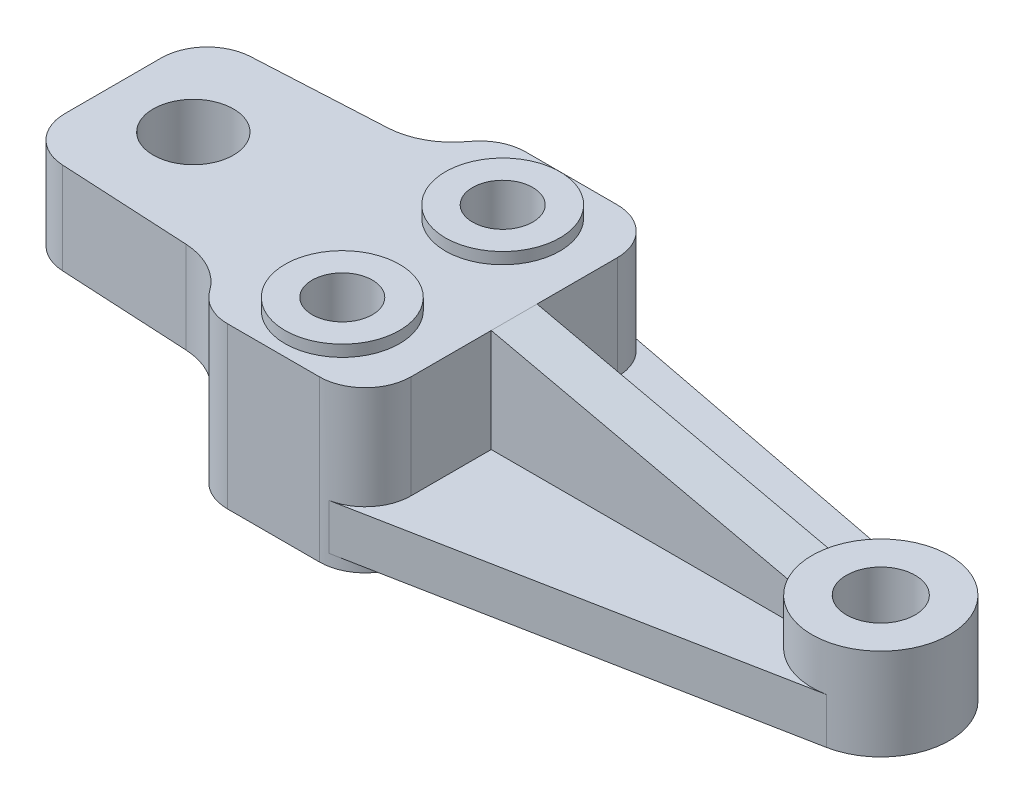
from build123d import *

# Parameters (mm, degrees)
SKETCH1_R                = 8.334375
SKETCH1_R_2              = 19.05
SKETCH1_R_3              = 9.525
SKETCH1_R_4              = 15.875
BOSS_EXTRUDE3_DEPTH      = 12.7
BOSS_EXTRUDE4_DEPTH      = 41.275
BOSS_EXTRUDE4_DEPTH_BACK = 3.175
SKETCH1_5_R              = 8.334375
SKETCH1_5_R_2            = 15.875
SKETCH1_6_R              = 19.05
SKETCH1_6_R_2            = 9.525
BOSS_EXTRUDE5_DEPTH      = 25.4
RIB1_START               = -6.35
RIB1_DEPTH               = 12.7
BOSS_EXTRUDE6_START      = 41.275
SKETCH1_7_R              = 15.875
SKETCH1_7_R_2            = 8.334375
BOSS_EXTRUDE6_DEPTH      = 3.175
BOSS_EXTRUDE8_START      = -25.4
SKETCH4_R                = 11.1125
BOSS_EXTRUDE8_DEPTH      = 25.4


# Read off the part's stored shape, not the designer's step: Rib1
with BuildPart() as part:
    # Sketch1 → Boss-Extrude3 (new body)
    # profile 1 of 5: a face of its own
    with BuildSketch(Plane(origin=(0, 0, 0), x_dir=(1, 0, 0), z_dir=(0, 1, 0))):
        with BuildLine():
            ThreePointArc((40.51167311, 41.043914661), (47.895872817, 36.657751744), (50.8, 28.575))
            Line((50.8, 28.575), (50.8, -28.575))
            ThreePointArc((50.8, -28.575), (47.895872817, -36.657751744), (40.51167311, -41.043914661))
            Line((40.51167311, -41.043914661), (156.017509664, -18.703371991))
            ThreePointArc((156.017509664, -18.703371991), (133.35, 0), (156.017509664, 18.703371991))
            Line((156.017509664, 18.703371991), (40.51167311, 41.043914661))
        make_face()
    # profile 2 of 5: a face of its own
    with BuildSketch(Plane(origin=(0, 0, 0), x_dir=(1, 0, 0), z_dir=(0, 1, 0))):
        with BuildLine():
            ThreePointArc((38.1, 41.275), (47.080256121, 37.555256121), (50.8, 28.575))
            Line((50.8, 28.575), (50.8, -28.575))
            ThreePointArc((50.8, -28.575), (47.080256121, -37.555256121), (38.1, -41.275))
            Line((38.1, -41.275), (12.7, -41.275))
            ThreePointArc((12.7, -41.275), (3.719743879, -37.555256121), (0, -28.575))
            Line((0, -28.575), (0, 28.575))
            ThreePointArc((0, 28.575), (3.719743879, 37.555256121), (12.7, 41.275))
            Line((12.7, 41.275), (38.1, 41.275))
        make_face()
        with Locations(Location((25.4, -22.225, 0), (0, 0, 270))):
            Circle(SKETCH1_R, mode=Mode.SUBTRACT)
        with Locations(Location((25.4, 22.225, 0), (0, 0, 270))):
            Circle(SKETCH1_R, mode=Mode.SUBTRACT)
    # profile 3 of 5: a face of its own
    with BuildSketch(Plane(origin=(0, 0, 0), x_dir=(1, 0, 0), z_dir=(0, 1, 0))):
        with Locations((152.4, 0)):
            Circle(SKETCH1_R_2)
        with Locations(Location((152.4, 0, 0), (0, 0, 270))):
            Circle(SKETCH1_R_3, mode=Mode.SUBTRACT)
    # profile 4 of 5: a face of its own
    with BuildSketch(Plane(origin=(0, 0, 0), x_dir=(1, 0, 0), z_dir=(0, 1, 0))):
        with Locations((25.4, 22.225)):
            Circle(SKETCH1_R_4)
        with Locations(Location((25.4, 22.225, 0), (0, 0, 270))):
            Circle(SKETCH1_R, mode=Mode.SUBTRACT)
    # profile 5 of 5: a face of its own
    with BuildSketch(Plane(origin=(0, 0, 0), x_dir=(1, 0, 0), z_dir=(0, 1, 0))):
        with Locations((25.4, -22.225)):
            Circle(SKETCH1_R_4)
        with Locations(Location((25.4, -22.225, 0), (0, 0, 270))):
            Circle(SKETCH1_R, mode=Mode.SUBTRACT)
    extrude(amount=BOSS_EXTRUDE3_DEPTH)

    # Sketch1<5> → Boss-Extrude4 (add, two sides: drawn at the far end of the back side and taken through both)
    # profile 1 of 3: a face of its own
    with BuildSketch(Plane(origin=(0, 0, 0), x_dir=(1, 0, 0), z_dir=(0, 1, 0)).offset(-BOSS_EXTRUDE4_DEPTH_BACK)):
        with BuildLine():
            ThreePointArc((38.1, 41.275), (47.080256121, 37.555256121), (50.8, 28.575))
            Line((50.8, 28.575), (50.8, -28.575))
            ThreePointArc((50.8, -28.575), (47.080256121, -37.555256121), (38.1, -41.275))
            Line((38.1, -41.275), (12.7, -41.275))
            ThreePointArc((12.7, -41.275), (3.719743879, -37.555256121), (0, -28.575))
            Line((0, -28.575), (0, 28.575))
            ThreePointArc((0, 28.575), (3.719743879, 37.555256121), (12.7, 41.275))
            Line((12.7, 41.275), (38.1, 41.275))
        make_face()
        with Locations(Location((25.4, -22.225, 0), (0, 0, 270))):
            Circle(SKETCH1_5_R, mode=Mode.SUBTRACT)
        with Locations(Location((25.4, 22.225, 0), (0, 0, 270))):
            Circle(SKETCH1_5_R, mode=Mode.SUBTRACT)
    # profile 2 of 3: a face of its own
    with BuildSketch(Plane(origin=(0, 0, 0), x_dir=(1, 0, 0), z_dir=(0, 1, 0)).offset(-BOSS_EXTRUDE4_DEPTH_BACK)):
        with Locations((25.4, -22.225)):
            Circle(SKETCH1_5_R_2)
        with Locations(Location((25.4, -22.225, 0), (0, 0, 270))):
            Circle(SKETCH1_5_R, mode=Mode.SUBTRACT)
    # profile 3 of 3: a face of its own
    with BuildSketch(Plane(origin=(0, 0, 0), x_dir=(1, 0, 0), z_dir=(0, 1, 0)).offset(-BOSS_EXTRUDE4_DEPTH_BACK)):
        with Locations((25.4, 22.225)):
            Circle(SKETCH1_5_R_2)
        with Locations(Location((25.4, 22.225, 0), (0, 0, 270))):
            Circle(SKETCH1_5_R, mode=Mode.SUBTRACT)
    extrude(amount=BOSS_EXTRUDE4_DEPTH + BOSS_EXTRUDE4_DEPTH_BACK)

    # Sketch1<6> → Boss-Extrude5 (add)
    with BuildSketch(Plane(origin=(0, 0, 0), x_dir=(1, 0, 0), z_dir=(0, 1, 0))):
        with Locations(Location((152.4, 0, 0), (0, 0, 79.053313044))):
            Circle(SKETCH1_6_R)
        with Locations(Location((152.4, 0, 0), (0, 0, 270))):
            Circle(SKETCH1_6_R_2, mode=Mode.SUBTRACT)
    extrude(amount=BOSS_EXTRUDE5_DEPTH)

    # Rib1 outline → Rib1 (add)
    with BuildSketch(Plane.XY.offset(RIB1_START)):
        Polygon((134.439487758, 22.361197239), (50.8, 41.275), (50.8, 12.7), (136, 12.7), (136, 22.008311042), align=None)
    extrude(amount=RIB1_DEPTH)

    # Sketch1<7> → Boss-Extrude6 (add)
    # profile 1 of 2: a face of its own
    with BuildSketch(Plane(origin=(0, 0, 0), x_dir=(1, 0, 0), z_dir=(0, 1, 0)).offset(BOSS_EXTRUDE6_START)):
        with Locations(Location((25.4, -22.225, 0), (0, 0, 270))):
            Circle(SKETCH1_7_R)
        with Locations(Location((25.4, -22.225, 0), (0, 0, 270))):
            Circle(SKETCH1_7_R_2, mode=Mode.SUBTRACT)
    # profile 2 of 2: a face of its own
    with BuildSketch(Plane(origin=(0, 0, 0), x_dir=(1, 0, 0), z_dir=(0, 1, 0)).offset(BOSS_EXTRUDE6_START)):
        with Locations(Location((25.4, 22.225, 0), (0, 0, 270))):
            Circle(SKETCH1_7_R)
        with Locations(Location((25.4, 22.225, 0), (0, 0, 270))):
            Circle(SKETCH1_7_R_2, mode=Mode.SUBTRACT)
    extrude(amount=BOSS_EXTRUDE6_DEPTH)

    # Sketch4 → Boss-Extrude8 (add)
    with BuildSketch(Plane(origin=(0, 41.275, 0), x_dir=(1, 0, 0), z_dir=(0, 1, 0)).offset(BOSS_EXTRUDE8_START)):
        with BuildLine():
            ThreePointArc((0, 28.575), (0.600462467, 32.43391066), (2.345069525, 35.927918798))
            ThreePointArc((2.345069525, 35.927918798), (-4.004870137, 30.266431204), (-12.186080417, 27.933627346))
            Line((-12.186080417, 27.933627346), (-48.292497181, 26.033289622))
            ThreePointArc((-48.292497181, 26.033289622), (-56.838230003, 22.091918232), (-60.325, 13.35084319))
            Line((-60.325, 13.35084319), (-60.325, -13.35084319))
            ThreePointArc((-60.325, -13.35084319), (-56.838230003, -22.091918232), (-48.292497181, -26.033289622))
            Line((-48.292497181, -26.033289622), (-12.186080417, -27.933627346))
            ThreePointArc((-12.186080417, -27.933627346), (-4.004870137, -30.266431204), (2.345069525, -35.927918798))
            ThreePointArc((2.345069525, -35.927918798), (0.600462467, -32.43391066), (0, -28.575))
            Line((0, -28.575), (0, 28.575))
        make_face()
        with Locations(Location((-38.1, 0, 0), (0, 0, 270))):
            Circle(SKETCH4_R, mode=Mode.SUBTRACT)
    extrude(amount=BOSS_EXTRUDE8_DEPTH)


solid = part.part
